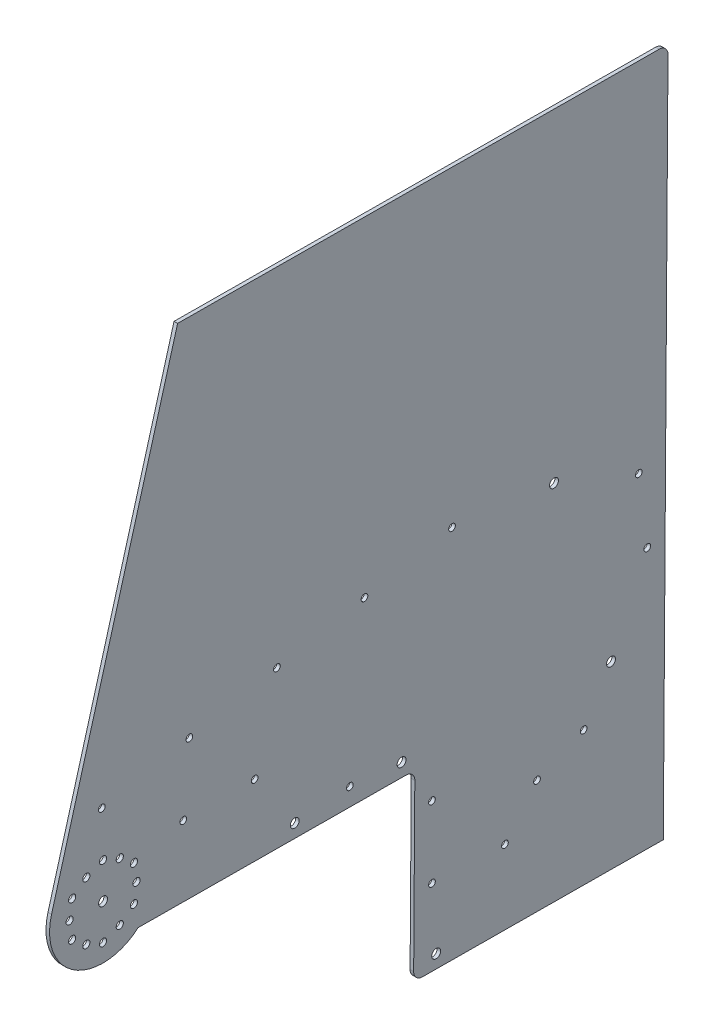
from build123d import *

# Parameters (mm, degrees)
SKETCH1_R           = 3.175
BOSS_EXTRUDE1_DEPTH = 2.54
SKETCH2_R           = 2.38125
CUT_EXTRUDE1_DEPTH  = 871.891718915
SKETCH5_R           = 2.5527
CUT_EXTRUDE2_DEPTH  = 871.891718915


with BuildPart() as part:
    # Sketch1 → Boss-Extrude1 (new body)
    with BuildSketch(Plane(origin=(2097.33945945, 0, 0), x_dir=(0, 0, -1), z_dir=(1, 0, 0))):
        with BuildLine():
            Line((813.354322932, 291.902453927), (470.462593133, 294.283973481))
            Line((470.462593133, 294.283973481), (380.69060226, -25.250155611))
            ThreePointArc((380.69060226, -25.250155611), (396.988966218, -67.7453513), (442.372216694, -64.304580962))
            Line((442.372216694, -64.304580962), (633.066836095, -65.629031002))
            ThreePointArc((633.066836095, -65.629031002), (637.543938621, -67.520043059), (639.372580729, -72.022980064))
            Line((639.372580729, -72.022980064), (638.556689771, -189.495146754))
            ThreePointArc((638.556689771, -189.495146754), (640.385331878, -193.998083759), (644.862434405, -195.889095816))
            Line((644.862434405, -195.889095816), (816.308299304, -197.079855594))
            Line((816.308299304, -197.079855594), (819.660067566, 285.508504864))
            ThreePointArc((819.660067566, 285.508504864), (817.831425459, 290.01144187), (813.354322932, 291.902453927))
        make_face()
        with Locations((553.895503221, -55.553924847)):
            Circle(SKETCH1_R, mode=Mode.SUBTRACT)
        with Locations((654.585392145, -186.431395895)):
            Circle(SKETCH1_R, mode=Mode.SUBTRACT)
        with Locations((629.958065992, -56.082209622)):
            Circle(SKETCH1_R, mode=Mode.SUBTRACT)
        with Locations((779.099930223, -68.570323835)):
            Circle(SKETCH1_R, mode=Mode.SUBTRACT)
        with Locations((738.492000758, 61.775645376)):
            Circle(SKETCH1_R, mode=Mode.SUBTRACT)
        with Locations((417.370503221, -35.55524491)):
            Circle(SKETCH1_R, mode=Mode.SUBTRACT)
    extrude(amount=BOSS_EXTRUDE1_DEPTH)

    # Sketch2 → Cut-Extrude1 (cut, through all)
    with BuildSketch(Plane(origin=(2099.87945945, 0, 0), x_dir=(0, 0, -1), z_dir=(1, 0, 0))):
        with Locations((759.618090186, -100.982485439)):
            Circle(SKETCH2_R)
        with Locations((541.187693092, 46.53204311)):
            Circle(SKETCH2_R)
        with Locations((478.851639869, 34.42970992)):
            Circle(SKETCH2_R)
        with Locations((416.515586647, 22.327376731)):
            Circle(SKETCH2_R)
        with Locations((525.320503221, -14.245042905)):
            Circle(SKETCH2_R)
        with Locations((798.886947172, 37.479390763)):
            Circle(SKETCH2_R)
        with Locations((665.859799537, 70.736709489)):
            Circle(SKETCH2_R)
        with Locations((603.523746314, 58.634376299)):
            Circle(SKETCH2_R)
        with Locations((703.559149884, -143.519538535)):
            Circle(SKETCH2_R)
        with Locations((726.384244699, -115.392244277)):
            Circle(SKETCH2_R)
        with Locations((804.898658391, -11.249556635)):
            Circle(SKETCH2_R)
        with Locations((474.520503221, -14.245042905)):
            Circle(SKETCH2_R)
        with Locations((651.589984927, -141.551336746)):
            Circle(SKETCH2_R)
        with Locations((651.589984927, -90.751336746)):
            Circle(SKETCH2_R)
        with Locations((593.128456503, -52.651336746)):
            Circle(SKETCH2_R)
    extrude(amount=-CUT_EXTRUDE1_DEPTH, mode=Mode.SUBTRACT)

    # Sketch5 → Cut-Extrude2 (cut, through all)
    with BuildSketch(Plane(origin=(2099.87945945, 0, 0), x_dir=(0, 0, -1), z_dir=(1, 0, 0))):
        with Locations((395.373457964, -48.255244909)):
            Circle(SKETCH5_R)
        with Locations((405.46425322, -56.177474835)):
            Circle(SKETCH5_R)
        with Locations((395.373457964, -22.855244907)):
            Circle(SKETCH5_R)
        with Locations((393.55800322, -35.555244908)):
            Circle(SKETCH5_R)
        with Locations((417.370503221, -10.155244906)):
            Circle(SKETCH5_R)
        with Locations((405.46425322, -14.93301498)):
            Circle(SKETCH5_R)
        with Locations((439.367548478, -22.855244907)):
            Circle(SKETCH5_R)
        with Locations((429.276753221, -14.93301498)):
            Circle(SKETCH5_R)
        with Locations((439.367548478, -48.255244909)):
            Circle(SKETCH5_R)
        with Locations((441.183003221, -35.555244908)):
            Circle(SKETCH5_R)
        with Locations((417.370503221, -60.955244909)):
            Circle(SKETCH5_R)
        with Locations((429.276753221, -56.177474835)):
            Circle(SKETCH5_R)
    extrude(amount=-CUT_EXTRUDE2_DEPTH, mode=Mode.SUBTRACT)


solid = part.part
